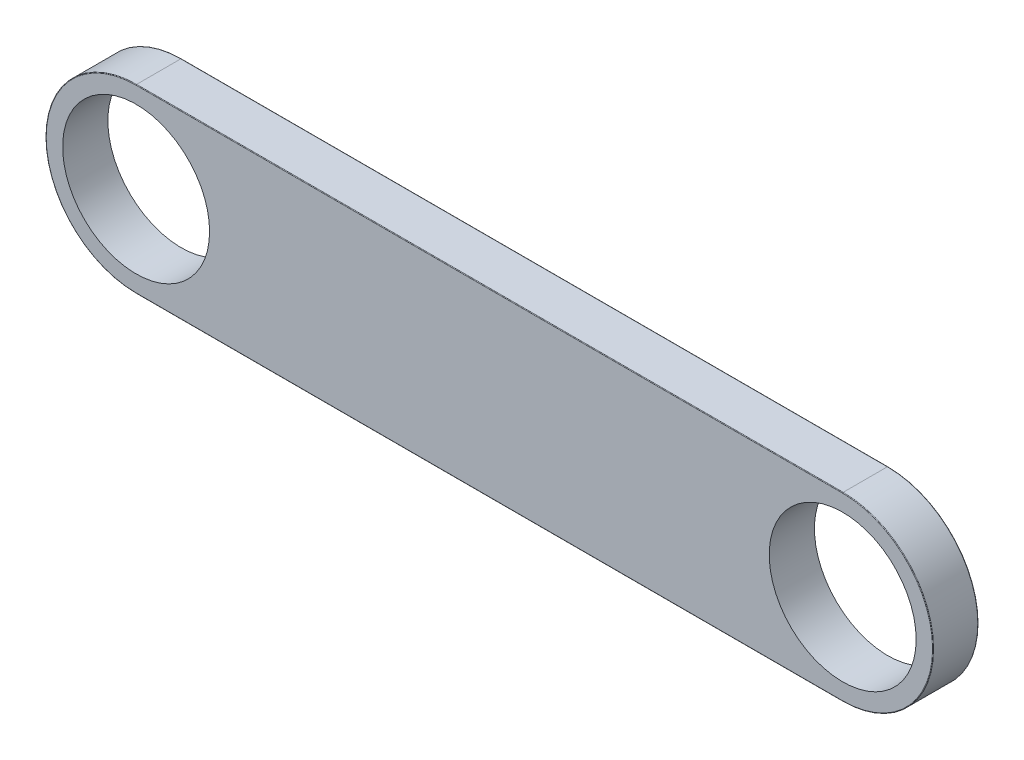
from build123d import *

# Parameters (mm, degrees)
SKETCH1_R           = 13
BOSS_EXTRUDE1_DEPTH = 8
FILLET1_R           = 0.1


with BuildPart() as part:
    # Sketch1 → Boss-Extrude1 (new body)
    with BuildSketch(Plane.XY):
        with BuildLine():
            Line((0, 16), (125, 16))
            ThreePointArc((125, 16), (141, 0), (125, -16))
            Line((125, -16), (0, -16))
            ThreePointArc((0, -16), (-16, 0), (0, 16))
        make_face()
        Circle(SKETCH1_R, mode=Mode.SUBTRACT)
        with Locations((125, 0)):
            Circle(SKETCH1_R, mode=Mode.SUBTRACT)
    extrude(amount=BOSS_EXTRUDE1_DEPTH)

    # Fillet1
    fillet1_edges = [part.edges().sort_by_distance(p)[0] for p in [
        (141, 0, 0),
        (62.5, -16, 0),
        (-16, 0, 0),
        (141, 0, 8),
        (62.5, -16, 8),
        (-16, 0, 8),
        (62.5, 16, 0),
        (62.5, 16, 8),
    ]]
    fillet(fillet1_edges, radius=FILLET1_R)


solid = part.part
